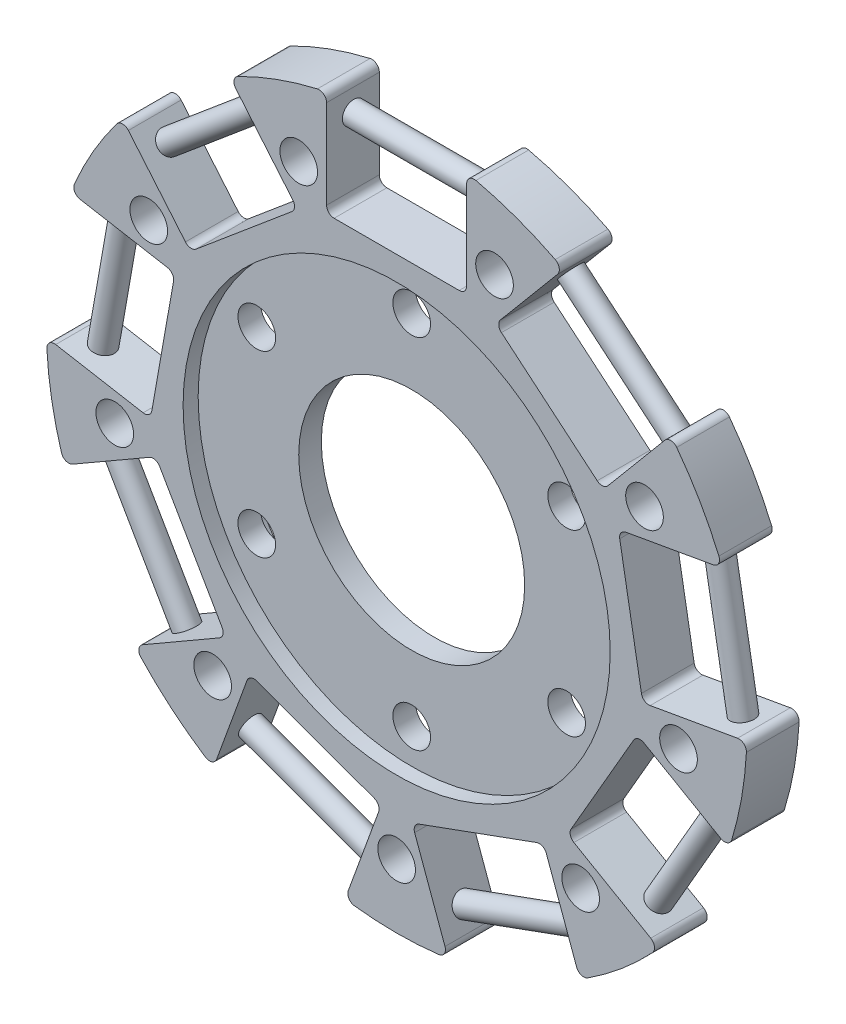
from build123d import *

# Parameters (mm, degrees)
BOSS_EXTRUDE1_DEPTH      = 3.5
SKETCH3_R                = 2.5
CUT_EXTRUDE4_DEPTH       = 11
SKETCH7_R                = 28.35
CUT_EXTRUDE5_DEPTH       = 2
CUT_EXTRUDE6_START       = -2
SKETCH10_R               = 28.35
CUT_EXTRUDE6_DEPTH       = 2
SKETCH12_R               = 15
CUT_EXTRUDE7_DEPTH       = 66.909328951
SKETCH13_R               = 1.5
BOSS_EXTRUDE2_DEPTH      = 18.5
CIRPATTERN1_START        = -9.2
CIRPATTERN1_OUTLINE_R    = 1.5
CIRPATTERN1_DEPTH        = 18.5
CIRPATTERN1_2_OUTLINE_R  = 1.5
CIRPATTERN1_2_DEPTH      = 18.5
CIRPATTERN1_3_OUTLINE_R  = 1.5
CIRPATTERN1_3_DEPTH      = 18.5
CIRPATTERN1_START_2      = -9.3
CIRPATTERN1_4_OUTLINE_R  = 1.5
CIRPATTERN1_4_DEPTH      = 18.5
CIRPATTERN1_5_OUTLINE_R  = 1.5
CIRPATTERN1_5_DEPTH      = 18.5
CIRPATTERN1_6_OUTLINE_R  = 1.5
CIRPATTERN1_6_DEPTH      = 18.5
CIRPATTERN1_7_OUTLINE_R  = 1.5
CIRPATTERN1_7_DEPTH      = 18.5
CIRPATTERN1_8_OUTLINE_R  = 1.5
CIRPATTERN1_8_DEPTH      = 18.5
SKETCH_1_R               = 2.5
CUT_EXTRUDE_1_DEPTH      = 66.909328951
PATTERN_CIRCULAR_1_COUNT = 6


# Read off the part's stored shape, not the designer's step: CirPattern1
with BuildPart() as part:
    # Sketch1 → Boss-Extrude1 (new, symmetric)
    with BuildSketch(Plane.XY):
        with BuildLine():
            Line((8.3, 31.537634409), (-8.3, 31.537634409))
            ThreePointArc((-8.3, 31.537634409), (-9.007106781, 31.830527627), (-9.3, 32.537634409))
            Line((-9.3, 32.537634409), (-9.3, 44.322482838))
            ThreePointArc((-9.3, 44.322482838), (-9.67804984, 45.105539668), (-10.526355997, 45.296527479))
            ThreePointArc((-10.526355997, 45.296527479), (-15.905148665, 43.699036811), (-21.052390107, 41.465364378))
            ThreePointArc((-21.052390107, 41.465364378), (-21.579465726, 40.773778539), (-21.365729478, 39.930916453))
            Line((-21.365729478, 39.930916453), (-13.790574925, 30.903198801))
            ThreePointArc((-13.790574925, 30.903198801), (-13.56042467, 30.173255449), (-13.913831759, 29.494366748))
            Line((-13.913831759, 29.494366748), (-26.630169515, 18.824092427))
            ThreePointArc((-26.630169515, 18.824092427), (-27.360112867, 18.593942172), (-28.039001567, 18.947349261))
            Line((-28.039001567, 18.947349261), (-35.61415612, 27.975066913))
            ThreePointArc((-35.61415612, 27.975066913), (-36.407098327, 28.331917493), (-37.179703143, 27.932941958))
            ThreePointArc((-37.179703143, 27.932941958), (-40.273250169, 23.251771826), (-42.780488909, 18.232096448))
            ThreePointArc((-42.780488909, 18.232096448), (-42.73970945, 17.363513283), (-42.034196679, 16.855230478))
            Line((-42.034196679, 16.855230478), (-30.428386578, 14.808813024))
            ThreePointArc((-30.428386578, 14.808813024), (-29.782882711, 14.397581707), (-29.617227003, 13.650357093))
            Line((-29.617227003, 13.650357093), (-32.499786752, -2.697451607))
            ThreePointArc((-32.499786752, -2.697451607), (-32.911018069, -3.342955474), (-33.658242683, -3.508611182))
            Line((-33.658242683, -3.508611182), (-45.264052784, -1.462193729))
            ThreePointArc((-45.264052784, -1.462193729), (-46.100860887, -1.698523751), (-46.436253982, -2.500777546))
            ThreePointArc((-46.436253982, -2.500777546), (-45.797050331, -8.07525561), (-44.491121499, -13.532172037))
            ThreePointArc((-44.491121499, -13.532172037), (-43.901568124, -14.171332813), (-43.034396096, -14.107205164))
            Line((-43.034396096, -14.107205164), (-32.828417977, -8.214780949))
            ThreePointArc((-32.828417977, -8.214780949), (-32.069598932, -8.114880527), (-31.462392573, -8.580806353))
            Line((-31.462392573, -8.580806353), (-23.162392573, -22.956828056))
            ThreePointArc((-23.162392573, -22.956828056), (-23.062492151, -23.715647101), (-23.528417977, -24.322853459))
            Line((-23.528417977, -24.322853459), (-33.734396096, -30.215277674))
            ThreePointArc((-33.734396096, -30.215277674), (-34.223518284, -30.934206854), (-33.964765501, -31.764355442))
            ThreePointArc((-33.964765501, -31.764355442), (-29.891901666, -35.6237812), (-25.383863875, -38.964586832))
            ThreePointArc((-25.383863875, -38.964586832), (-24.52139516, -39.075254789), (-23.898323306, -38.468722725))
            Line((-23.898323306, -38.468722725), (-19.867667757, -27.394587619))
            ThreePointArc((-19.867667757, -27.394587619), (-19.350593398, -26.830299975), (-18.585954993, -26.796915141))
            Line((-18.585954993, -26.796915141), (-2.987057488, -32.47444952))
            ThreePointArc((-2.987057488, -32.47444952), (-2.422769844, -32.991523879), (-2.389385011, -33.756162285))
            Line((-2.389385011, -33.756162285), (-6.420040559, -44.830297391))
            ThreePointArc((-6.420040559, -44.830297391), (-6.332611124, -45.695430776), (-5.600785766, -46.165038406))
            ThreePointArc((-5.600785766, -46.165038406), (0, -46.503543652), (5.600785766, -46.165038406))
            ThreePointArc((5.600785766, -46.165038406), (6.332611124, -45.695430776), (6.420040559, -44.830297391))
            Line((6.420040559, -44.830297391), (2.389385011, -33.756162285))
            ThreePointArc((2.389385011, -33.756162285), (2.422769844, -32.991523879), (2.987057488, -32.47444952))
            Line((2.987057488, -32.47444952), (18.585954993, -26.796915141))
            ThreePointArc((18.585954993, -26.796915141), (19.350593398, -26.830299975), (19.867667757, -27.394587619))
            Line((19.867667757, -27.394587619), (23.898323306, -38.468722725))
            ThreePointArc((23.898323306, -38.468722725), (24.52139516, -39.075254789), (25.383863875, -38.964586832))
            ThreePointArc((25.383863875, -38.964586832), (29.891901666, -35.6237812), (33.964765501, -31.764355442))
            ThreePointArc((33.964765501, -31.764355442), (34.223518284, -30.934206854), (33.734396096, -30.215277674))
            Line((33.734396096, -30.215277674), (23.528417977, -24.322853459))
            ThreePointArc((23.528417977, -24.322853459), (23.062492151, -23.715647101), (23.162392573, -22.956828056))
            Line((23.162392573, -22.956828056), (31.462392573, -8.580806353))
            ThreePointArc((31.462392573, -8.580806353), (32.069598932, -8.114880527), (32.828417977, -8.214780949))
            Line((32.828417977, -8.214780949), (43.034396096, -14.107205164))
            ThreePointArc((43.034396096, -14.107205164), (43.901568124, -14.171332813), (44.491121499, -13.532172037))
            ThreePointArc((44.491121499, -13.532172037), (45.797050331, -8.07525561), (46.436253982, -2.500777546))
            ThreePointArc((46.436253982, -2.500777546), (46.100860887, -1.698523751), (45.264052784, -1.462193729))
            Line((45.264052784, -1.462193729), (33.658242683, -3.508611182))
            ThreePointArc((33.658242683, -3.508611182), (32.911018069, -3.342955474), (32.499786752, -2.697451607))
            Line((32.499786752, -2.697451607), (29.617227003, 13.650357093))
            ThreePointArc((29.617227003, 13.650357093), (29.782882711, 14.397581707), (30.428386578, 14.808813024))
            Line((30.428386578, 14.808813024), (42.034196679, 16.855230478))
            ThreePointArc((42.034196679, 16.855230478), (42.73970945, 17.363513283), (42.780488909, 18.232096448))
            ThreePointArc((42.780488909, 18.232096448), (40.273250169, 23.251771826), (37.179703143, 27.932941958))
            ThreePointArc((37.179703143, 27.932941958), (36.407098327, 28.331917493), (35.61415612, 27.975066913))
            Line((35.61415612, 27.975066913), (28.039001567, 18.947349261))
            ThreePointArc((28.039001567, 18.947349261), (27.360112867, 18.593942172), (26.630169515, 18.824092427))
            Line((26.630169515, 18.824092427), (13.913831759, 29.494366748))
            ThreePointArc((13.913831759, 29.494366748), (13.56042467, 30.173255449), (13.790574925, 30.903198801))
            Line((13.790574925, 30.903198801), (21.365729478, 39.930916453))
            ThreePointArc((21.365729478, 39.930916453), (21.579465726, 40.773778539), (21.052390107, 41.465364378))
            ThreePointArc((21.052390107, 41.465364378), (15.905148665, 43.699036811), (10.526355997, 45.296527479))
            ThreePointArc((10.526355997, 45.296527479), (9.67804984, 45.105539668), (9.3, 44.322482838))
            Line((9.3, 44.322482838), (9.3, 32.537634409))
            ThreePointArc((9.3, 32.537634409), (9.007106781, 31.830527627), (8.3, 31.537634409))
        make_face()
    extrude(amount=BOSS_EXTRUDE1_DEPTH, both=True)

    # Sketch3 → Cut-Extrude4 (cut)
    with BuildSketch(Plane.XY.offset(3.5)):
        with Locations((12.996765446, 35.70831959)):
            Circle(SKETCH3_R)
        with Locations((-12.996765446, 35.70831959)):
            Circle(SKETCH3_R)
        with Locations((32.908965344, 19)):
            Circle(SKETCH3_R)
        with Locations((37.422694614, -6.598630751)):
            Circle(SKETCH3_R)
        with Locations((24.425929168, -29.109688839)):
            Circle(SKETCH3_R)
        with Locations((0, -38)):
            Circle(SKETCH3_R)
        with Locations((-24.425929168, -29.109688839)):
            Circle(SKETCH3_R)
        with Locations((-37.422694614, -6.598630751)):
            Circle(SKETCH3_R)
        with Locations((-32.908965344, 19)):
            Circle(SKETCH3_R)
    extrude(amount=-CUT_EXTRUDE4_DEPTH, mode=Mode.SUBTRACT)

    # Sketch7 → Cut-Extrude5 (cut)
    with BuildSketch(Plane.XY.offset(3.5)):
        Circle(SKETCH7_R)
    extrude(amount=-CUT_EXTRUDE5_DEPTH, mode=Mode.SUBTRACT)

    # Sketch10 → Cut-Extrude6 (cut)
    with BuildSketch(Plane(origin=(0, 0, -3.5), x_dir=(-1, 0, 0), z_dir=(0, 0, -1)).offset(CUT_EXTRUDE6_START)):
        with Locations(Location((0, 0, 0), (0, 0, 180))):
            Circle(SKETCH10_R)
    extrude(amount=CUT_EXTRUDE6_DEPTH, mode=Mode.SUBTRACT)

    # Sketch12 → Cut-Extrude7 (cut, through all)
    with BuildSketch(Plane(origin=(0, 0, -1.5), x_dir=(-1, 0, 0), z_dir=(0, 0, -1))):
        Circle(SKETCH12_R)
    extrude(amount=-CUT_EXTRUDE7_DEPTH, mode=Mode.SUBTRACT)

    # Sketch13 → Boss-Extrude2 (add)
    with BuildSketch(Plane(origin=(7.124213321, -5.97792477, 0), x_dir=(0, 0, 1), z_dir=(-0.7660444431189782, 0.6427876096865393, 0))):
        with Locations(Location((0, 41.5, 0), (0, 0, 90))):
            Circle(SKETCH13_R)
    extrude(amount=BOSS_EXTRUDE2_DEPTH)

    # CirPattern1 outline → CirPattern1 (add)
    with BuildSketch(Plane.YZ.offset(CIRPATTERN1_START)):
        with Locations((41.5, 0)):
            Circle(CIRPATTERN1_OUTLINE_R)
    extrude(amount=CIRPATTERN1_DEPTH)

    # CirPattern1 2 outline → CirPattern1 2 (add)
    with BuildSketch(Plane(origin=(0, 0, 0), x_dir=(0.6427876096865098, -0.7660444431190029, 0), z_dir=(0.7660444431190028, 0.6427876096865099, 0)).offset(CIRPATTERN1_START)):
        with Locations((-41.5, 0)):
            Circle(CIRPATTERN1_2_OUTLINE_R)
    extrude(amount=CIRPATTERN1_2_DEPTH)

    # CirPattern1 3 outline → CirPattern1 3 (add)
    with BuildSketch(Plane(origin=(0, 0, 0), x_dir=(0.9848077530121979, -0.17364817766698804, 0), z_dir=(0.173648177666988, 0.984807753012198, 0)).offset(CIRPATTERN1_START)):
        with Locations((-41.5, 0)):
            Circle(CIRPATTERN1_3_OUTLINE_R)
    extrude(amount=CIRPATTERN1_3_DEPTH)

    # CirPattern1 4 outline → CirPattern1 4 (add)
    with BuildSketch(Plane(origin=(0, 0, 0), x_dir=(0.8660254037844768, 0.49999999999993383, 0), z_dir=(0.4999999999999339, -0.8660254037844768, 0)).offset(CIRPATTERN1_START_2)):
        with Locations((-41.5, 0)):
            Circle(CIRPATTERN1_4_OUTLINE_R)
    extrude(amount=CIRPATTERN1_4_DEPTH)

    # CirPattern1 5 outline → CirPattern1 5 (add)
    with BuildSketch(Plane(origin=(0, 0, 0), x_dir=(0.34202014332575803, 0.9396926207858759, 0), z_dir=(0.939692620785876, -0.342020143325758, 0)).offset(CIRPATTERN1_START_2)):
        with Locations((-41.5, 0)):
            Circle(CIRPATTERN1_5_OUTLINE_R)
    extrude(amount=CIRPATTERN1_5_DEPTH)

    # CirPattern1 6 outline → CirPattern1 6 (add)
    with BuildSketch(Plane(origin=(0, 0, 0), x_dir=(-0.34202014332555913, 0.9396926207859483, 0), z_dir=(0.9396926207859483, 0.34202014332555913, 0)).offset(CIRPATTERN1_START_2)):
        with Locations((-41.5, 0)):
            Circle(CIRPATTERN1_6_OUTLINE_R)
    extrude(amount=CIRPATTERN1_6_DEPTH)

    # CirPattern1 7 outline → CirPattern1 7 (add)
    with BuildSketch(Plane(origin=(0, 0, 0), x_dir=(0.8660254037843728, -0.500000000000114, 0), z_dir=(0.500000000000114, 0.8660254037843729, 0)).offset(CIRPATTERN1_START_2)):
        with Locations((41.5, 0)):
            Circle(CIRPATTERN1_7_OUTLINE_R)
    extrude(amount=CIRPATTERN1_7_DEPTH)

    # CirPattern1 8 outline → CirPattern1 8 (add)
    with BuildSketch(Plane(origin=(0, 0, 0), x_dir=(0.9848077530122347, 0.17364817766677898, 0), z_dir=(0.17364817766677898, -0.9848077530122348, 0)).offset(CIRPATTERN1_START)):
        with Locations((41.5, 0)):
            Circle(CIRPATTERN1_8_OUTLINE_R)
    extrude(amount=CIRPATTERN1_8_DEPTH)

    # 草圖1 → 除料-伸長1 (cut, through all)
    with BuildSketch(Plane.XY.offset(1.5)):
        with Locations((0, 23.75)):
            Circle(SKETCH_1_R)
    cut_extrude_1 = extrude(amount=-CUT_EXTRUDE_1_DEPTH, mode=Mode.SUBTRACT)

    # 環狀複製排列1: 除料-伸長1 ×6 about axis
    pattern_circular_1_axis = Axis((0, 0, 0), (0, 0, 1))
    for i in range(1, PATTERN_CIRCULAR_1_COUNT):
        add(cut_extrude_1.rotate(pattern_circular_1_axis, i * 360 / PATTERN_CIRCULAR_1_COUNT), mode=Mode.SUBTRACT)


solid = part.part
